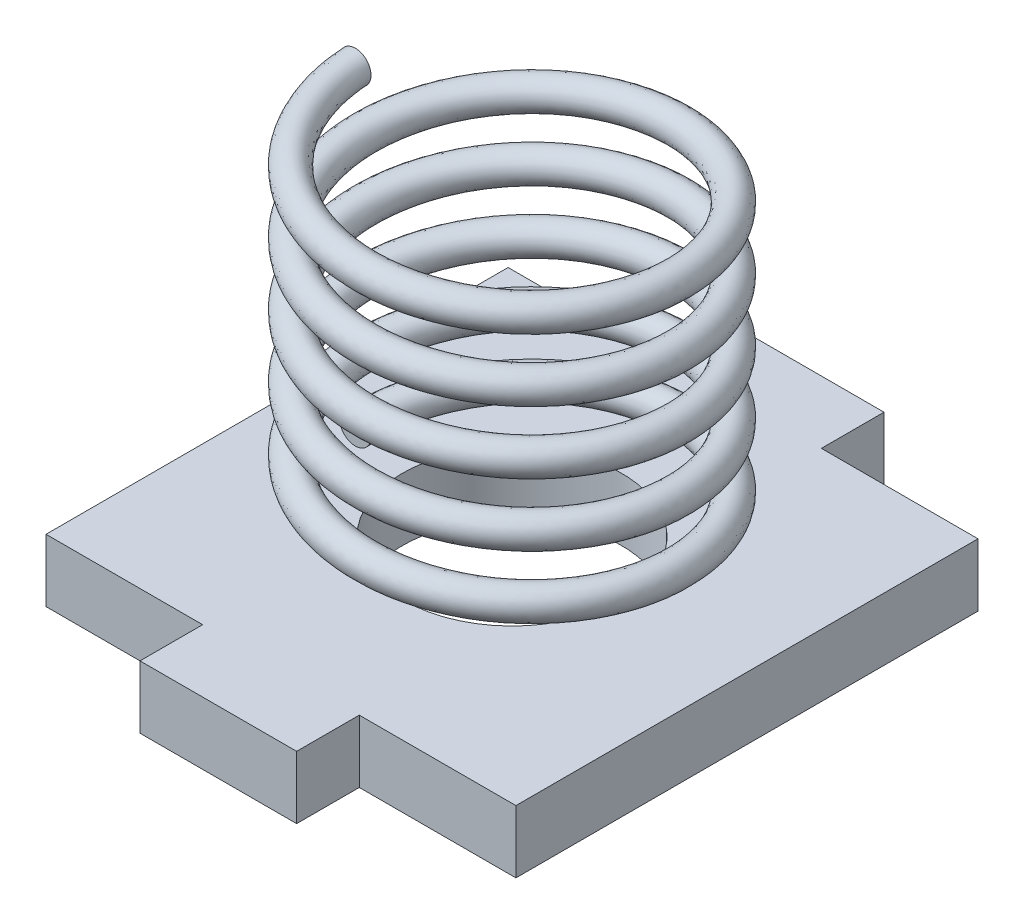
from build123d import *

# Parameters (mm, degrees)
BOSS_EXTRUDE1_DEPTH = 2
SKETCH3_R           = 3.5
CUT_EXTRUDE1_DEPTH  = 12.4
SWEEP2_PITCH        = 2
SWEEP2_HEIGHT       = 10
SWEEP2_RADIUS       = 5
SWEEP2_START_ANGLE  = -90
SKETCH8_R           = 0.5


with BuildPart() as part:
    # Sketch2 → Boss-Extrude1 (new body)
    with BuildSketch(Plane(origin=(0, 0, 0), x_dir=(1, 0, 0), z_dir=(0, 1, 0))):
        Polygon((5, 0), (10, 0), (10, 2), (15, 2), (15, 16.75), (10, 16.75), (10, 18.75), (5, 18.75), (5, 16.75), (0, 16.75), (0, 2), (5, 2), align=None)
    extrude(amount=BOSS_EXTRUDE1_DEPTH)

    # Sketch3 → Cut-Extrude1 (cut)
    with BuildSketch(Plane(origin=(0, 2, 0), x_dir=(1, 0, 0), z_dir=(0, 1, 0))):
        with Locations(Location((7.5, 9.375, 0), (0, 0, 270))):
            Circle(SKETCH3_R)
    extrude(amount=-CUT_EXTRUDE1_DEPTH, mode=Mode.SUBTRACT)


with BuildPart() as body_2:
    # Sweep2: sweep along a helix
    with BuildLine() as sweep2_path:
        add(Helix(SWEEP2_PITCH, SWEEP2_HEIGHT, SWEEP2_RADIUS, center=(7.5, 2.5, -9.375), direction=(0, 1, 0), lefthand=True, mode=Mode.PRIVATE).rotate(Axis((7.5, 2.5, -9.375), (0, 1, 0)), SWEEP2_START_ANGLE))
    # Sketch8 → Sweep2 (sweep)
    with BuildSketch(Plane.XY.offset(-9.375)):
        with Locations((2.5, 12.5)):
            Circle(SKETCH8_R)
    sweep(path=sweep2_path.line, is_frenet=True)


solid = Compound([part.part, body_2.part])
